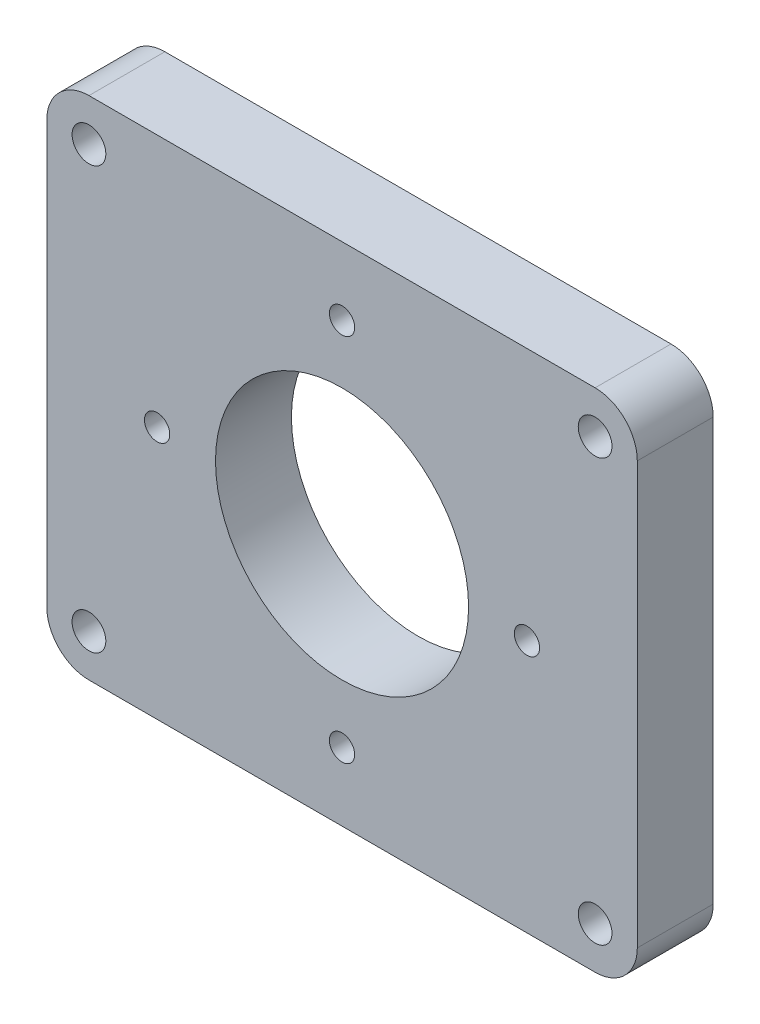
from build123d import *

# Parameters (mm, degrees)
ESQUISSE1_W             = 70
ESQUISSE1_H             = 60
BOSS_EXTRU_1_DEPTH      = 9
ESQUISSE2_R             = 15
ESQUISSE2_R_2           = 1.5
ESQUISSE2_R_3           = 2
ENL_V_MAT_EXTRU_1_DEPTH = 93.633687177
CONG_1_R                = 5


with BuildPart() as part:
    # Esquisse1 → Boss.-Extru.1 (new body)
    with BuildSketch(Plane.XY):
        with Locations((35, 30)):
            Rectangle(ESQUISSE1_W, ESQUISSE1_H)
    extrude(amount=BOSS_EXTRU_1_DEPTH)

    # Esquisse2 → Enlèv. mat.-Extru.1 (cut, through all)
    with BuildSketch(Plane.XY.offset(9)):
        with Locations((35, 30)):
            Circle(ESQUISSE2_R)
        with Locations((56.920310217, 30)):
            Circle(ESQUISSE2_R_2)
        with Locations((35, 51.920310217)):
            Circle(ESQUISSE2_R_2)
        with Locations((13.079689783, 30)):
            Circle(ESQUISSE2_R_2)
        with Locations((35, 8.079689783)):
            Circle(ESQUISSE2_R_2)
        with Locations((5, 55)):
            Circle(ESQUISSE2_R_3)
        with Locations((65, 55)):
            Circle(ESQUISSE2_R_3)
        with Locations((65, 5)):
            Circle(ESQUISSE2_R_3)
        with Locations((5, 5)):
            Circle(ESQUISSE2_R_3)
    extrude(amount=-ENL_V_MAT_EXTRU_1_DEPTH, mode=Mode.SUBTRACT)

    # Congé1
    cong_1_edges = [part.edges().sort_by_distance(p)[0] for p in [
        (70, 0, 4.5),
        (0, 0, 4.5),
        (70, 60, 4.5),
        (0, 60, 4.5),
    ]]
    fillet(cong_1_edges, radius=CONG_1_R)


solid = part.part
